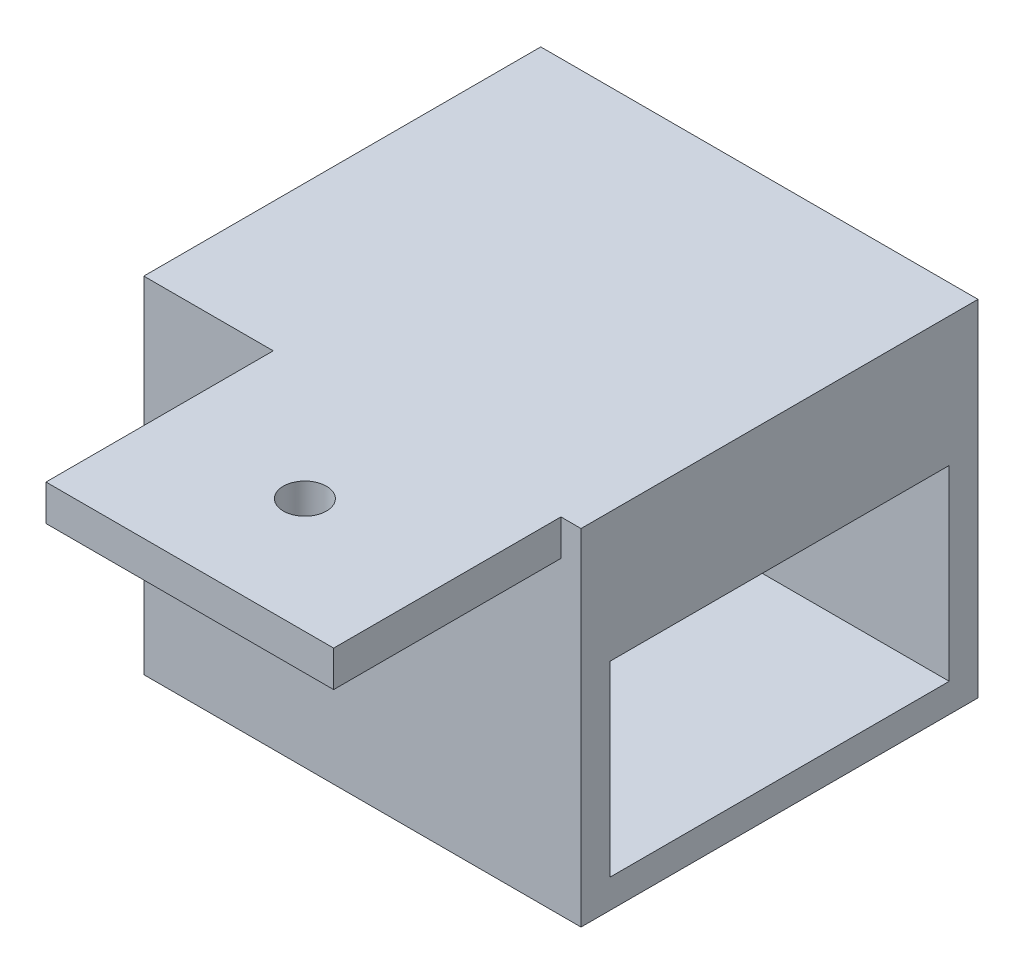
from build123d import *

# Parameters (mm, degrees)
S_BOX1_W       = 20
S_BOX1_H       = 2.5
BOSS_1_DEPTH   = 42
S_BOX2_W       = 30.4
S_BOX2_H       = 24
BOSS_2_DEPTH   = 27.6
S_CUT3_W       = 30.6
S_CUT3_H       = 13
POCKET_3_DEPTH = 23.6
S_CUT4_W       = 23
S_CUT4_H       = 4
POCKET_4_DEPTH = 23.7
S_HOLE5_R      = 1.5
HOLE_5_DEPTH   = 2.7


with BuildPart() as part:
    # S_box1 → Boss_1 (new body)
    with BuildSketch(Plane.XY.offset(-34)):
        with Locations((0, -2.75)):
            Rectangle(S_BOX1_W, S_BOX1_H)
    extrude(amount=BOSS_1_DEPTH)

    # S_box2 → Boss_2 (add)
    with BuildSketch(Plane.XY.offset(-35.4)):
        with Locations((-3.8, -13.5)):
            Rectangle(S_BOX2_W, S_BOX2_H)
    extrude(amount=BOSS_2_DEPTH)

    # S_cut3 → Pocket_3 (cut)
    with BuildSketch(Plane.XY.offset(-33.4)):
        with Locations((-3.8, -17)):
            Rectangle(S_CUT3_W, S_CUT3_H)
    extrude(amount=POCKET_3_DEPTH, mode=Mode.SUBTRACT)

    # S_cut4 → Pocket_4 (cut)
    with BuildSketch(Plane.XY.offset(-35.5)):
        with Locations((-3.5, -6.5)):
            Rectangle(S_CUT4_W, S_CUT4_H)
    extrude(amount=POCKET_4_DEPTH, mode=Mode.SUBTRACT)

    # S_hole5 → Hole_5 (cut)
    with BuildSketch(Plane(origin=(0, -4.1, 0), x_dir=(1, 0, 0), z_dir=(0, 1, 0))):
        Circle(S_HOLE5_R)
    extrude(amount=HOLE_5_DEPTH, mode=Mode.SUBTRACT)


solid = part.part
